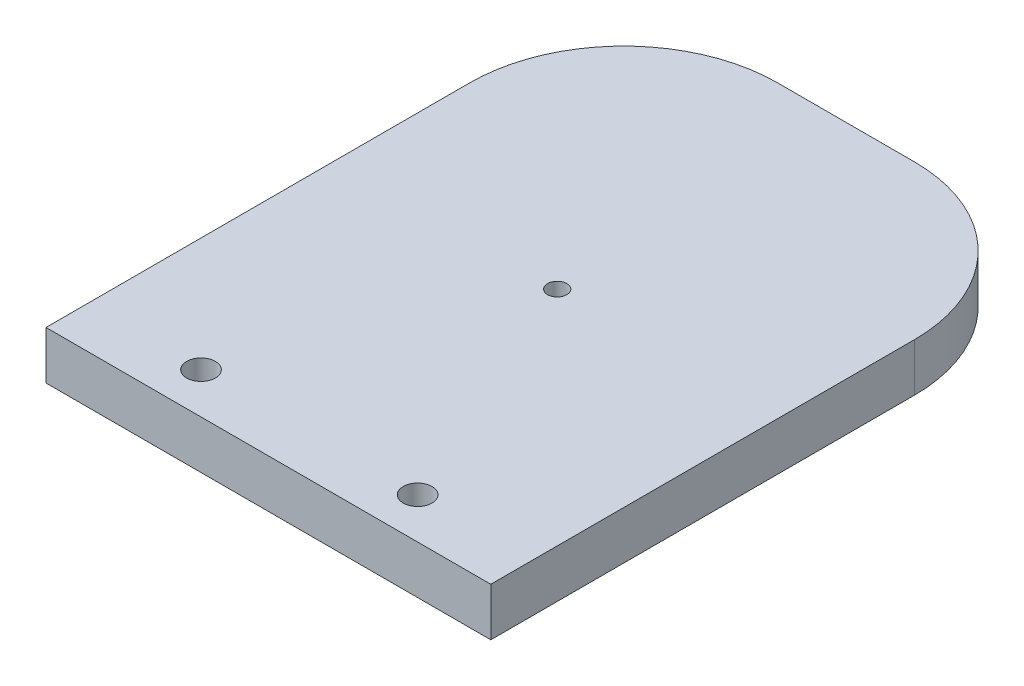
from build123d import *

# Parameters (mm, degrees)
SKETCH1_W           = 58.674
SKETCH1_H           = 76.2
BOSS_EXTRUDE1_DEPTH = 6.35
CUT_EXTRUDE1_DEPTH  = 97.381537527
SKETCH3_W           = 58.674
SKETCH3_H           = 6.35
BOSS_EXTRUDE2_DEPTH = 7.62
SKETCH4_W           = 15.24
SKETCH4_H           = 7.62
CUT_EXTRUDE2_DEPTH  = 97.381537527
FILLET1_R           = 3.175
SKETCH5_R           = 2.54
CUT_EXTRUDE3_DEPTH  = 88.939040568
FILLET2_R           = 20.32
SKETCH7_W           = 58.92775625
SKETCH7_H           = 8.241690561
CUT_EXTRUDE4_DEPTH  = 97.381537527
SKETCH8_R           = 1.89865
CUT_EXTRUDE5_DEPTH  = 97.381537527


with BuildPart() as part:
    # Sketch1 → Boss-Extrude1 (new body)
    with BuildSketch(Plane(origin=(0, 0, 0), x_dir=(1, 0, 0), z_dir=(0, 1, 0))):
        with Locations((29.337, 38.1)):
            Rectangle(SKETCH1_W, SKETCH1_H)
    extrude(amount=BOSS_EXTRUDE1_DEPTH)

    # Sketch2 → Cut-Extrude1 (cut, through all)
    with BuildSketch(Plane(origin=(0, 6.35, 0), x_dir=(1, 0, 0), z_dir=(0, 1, 0))):
        with BuildLine():
            ThreePointArc((30.607, 38.1), (29.337, 39.37), (28.067, 38.1))
            Line((28.067, 38.1), (30.607, 38.1))
        make_face()
        with BuildLine():
            Line((30.607, 38.1), (28.067, 38.1))
            ThreePointArc((28.067, 38.1), (29.337, 36.83), (30.607, 38.1))
        make_face()
    extrude(amount=-CUT_EXTRUDE1_DEPTH, mode=Mode.SUBTRACT)

    # Sketch3 → Boss-Extrude2 (add)
    with BuildSketch(Plane.XY):
        with Locations((29.337, 3.175)):
            Rectangle(SKETCH3_W, SKETCH3_H)
    extrude(amount=BOSS_EXTRUDE2_DEPTH)

    # Sketch4 → Cut-Extrude2 (cut, through all)
    with BuildSketch(Plane(origin=(0, 6.35, 0), x_dir=(1, 0, 0), z_dir=(0, 1, 0))):
        with Locations((7.62, -3.81)):
            Rectangle(SKETCH4_W, SKETCH4_H)
        with Locations((29.337, -3.81)):
            Rectangle(SKETCH4_W, SKETCH4_H)
        with Locations((51.054, -3.81)):
            Rectangle(SKETCH4_W, SKETCH4_H)
    extrude(amount=-CUT_EXTRUDE2_DEPTH, mode=Mode.SUBTRACT)

    # Fillet1
    fillet1_edges = [part.edges().sort_by_distance(p)[0] for p in [
        (40.1955, 0, 7.62),
        (40.1955, 6.35, 7.62),
        (18.4785, 0, 7.62),
        (18.4785, 6.35, 7.62),
    ]]
    fillet(fillet1_edges, radius=FILLET1_R - 0.0001)  # a hair under: the kernel refuses the full size

    # Sketch5 → Cut-Extrude3 (cut, through all)
    with BuildSketch(Plane(origin=(43.434, 0, 0), x_dir=(0, 0, -1), z_dir=(1, 0, 0))):
        with Locations((-4.445, 3.175)):
            Circle(SKETCH5_R)
    extrude(amount=-CUT_EXTRUDE3_DEPTH, mode=Mode.SUBTRACT)

    # Fillet2
    fillet2_edges = [part.edges().sort_by_distance(p)[0] for p in [
        (0, 3.175, -76.2),
        (58.674, 3.175, -76.2),
    ]]
    fillet(fillet2_edges, radius=FILLET2_R)

    # Sketch7 → Cut-Extrude4 (cut, through all)
    with BuildSketch(Plane(origin=(0, 6.35, 0), x_dir=(1, 0, 0), z_dir=(0, 1, 0))):
        with Locations((29.463878125, -4.120845281)):
            Rectangle(SKETCH7_W, SKETCH7_H)
    extrude(amount=-CUT_EXTRUDE4_DEPTH, mode=Mode.SUBTRACT)

    # Sketch8 → Cut-Extrude5 (cut, through all)
    with BuildSketch(Plane(origin=(0, 6.35, 0), x_dir=(1, 0, 0), z_dir=(0, 1, 0))):
        with Locations(Location((43.6245, 5.3975, 0), (0, 0, 270))):
            Circle(SKETCH8_R)
        with Locations(Location((15.0495, 5.3975, 0), (0, 0, 270))):
            Circle(SKETCH8_R)
    extrude(amount=-CUT_EXTRUDE5_DEPTH, mode=Mode.SUBTRACT)


solid = part.part
